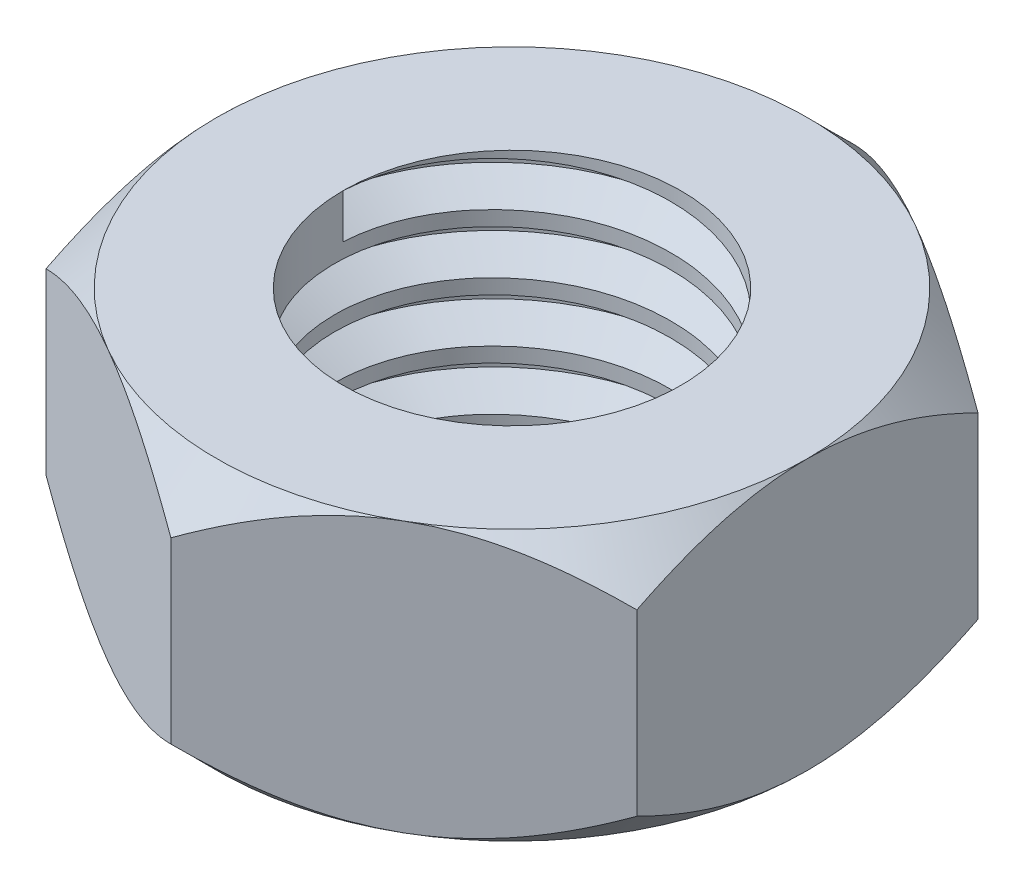
from build123d import *

# Parameters (mm, degrees)
BOSS_EXTRUDE2_DEPTH = 3.2
SKETCH2_R           = 2
CUT_EXTRUDE2_DEPTH  = 7.23083729
SKETCH3_OUTSIDE_W   = 17.632
SKETCH3_OUTSIDE_H   = 18.714
SKETCH3_OUTSIDE_R   = 3.5
CUT_EXTRUDE3_DEPTH  = 3.2
CUT_EXTRUDE3_DRAFT  = -45
SKETCH4_OUTSIDE_W   = 17.632
SKETCH4_OUTSIDE_H   = 18.714
SKETCH4_OUTSIDE_R   = 3.5
CUT_EXTRUDE4_DEPTH  = 3.2
CUT_EXTRUDE4_DRAFT  = -45
THREAD1_PITCH       = 0.7


with BuildPart() as part:
    # Sketch1 → Boss-Extrude2 (new body)
    with BuildSketch(Plane(origin=(0, 0, 0), x_dir=(1, 0, 0), z_dir=(0, 1, 0))):
        Polygon((0, 4.041451884), (-3.5, 2.020725942), (-3.5, -2.020725942), (0, -4.041451884), (3.5, -2.020725942), (3.5, 2.020725942), align=None)
    extrude(amount=BOSS_EXTRUDE2_DEPTH)

    # Sketch2 → Cut-Extrude2 (cut, through all)
    with BuildSketch(Plane(origin=(0, 3.2, 0), x_dir=(1, 0, 0), z_dir=(0, 1, 0))):
        with Locations(Location((0, 0, 0), (0, 0, 270))):
            Circle(SKETCH2_R)
    extrude(amount=-CUT_EXTRUDE2_DEPTH, mode=Mode.SUBTRACT)


with BuildPart() as cut_extrude3_tool:
    # Sketch3 outside → Cut-Extrude3 (with draft: the straight prism first)
    with BuildSketch(Plane(origin=(0, 3.2, 0), x_dir=(1, 0, 0), z_dir=(0, 1, 0))):
        Rectangle(SKETCH3_OUTSIDE_W, SKETCH3_OUTSIDE_H)
        Circle(SKETCH3_OUTSIDE_R, mode=Mode.SUBTRACT)
    extrude(amount=-CUT_EXTRUDE3_DEPTH)
    # Cut-Extrude3: the draft: its side faces are tilted about the plane it starts from
    cut_extrude3_sides = [cut_extrude3_tool.faces().sort_by_distance(p)[0] for p in [
        (0, 1.6, 9.357),
        (8.816, 1.6, 0),
        (0, 1.6, -9.357),
        (-8.816, 1.6, 0),
        (-3.5, 1.6, 0),
    ]]
    draft(cut_extrude3_sides, Plane(origin=(0, 3.2, 0), x_dir=(1, 0, 0), z_dir=(0, 1, 0)), CUT_EXTRUDE3_DRAFT)


with BuildPart() as part_1:
    add(part.part)

    # Cut-Extrude3: cut by cut_extrude3_tool
    add(cut_extrude3_tool.part, mode=Mode.SUBTRACT)


with BuildPart() as cut_extrude4_tool:
    # Sketch4 outside → Cut-Extrude4 (with draft: the straight prism first)
    with BuildSketch(Plane.XZ):
        Rectangle(SKETCH4_OUTSIDE_W, SKETCH4_OUTSIDE_H)
        Circle(SKETCH4_OUTSIDE_R, mode=Mode.SUBTRACT)
    extrude(amount=-CUT_EXTRUDE4_DEPTH)
    # Cut-Extrude4: the draft: its side faces are tilted about the plane it starts from
    cut_extrude4_sides = [cut_extrude4_tool.faces().sort_by_distance(p)[0] for p in [
        (0, 1.6, -9.357),
        (8.816, 1.6, 0),
        (0, 1.6, 9.357),
        (-8.816, 1.6, 0),
        (-3.5, 1.6, 0),
    ]]
    draft(cut_extrude4_sides, Plane.XZ, CUT_EXTRUDE4_DRAFT)


with BuildPart() as part_2:
    add(part_1.part)

    # Cut-Extrude4: cut by cut_extrude4_tool
    add(cut_extrude4_tool.part, mode=Mode.SUBTRACT)

    # Thread1: the profile of Thread Profile1 profile screwed along a right-hand helix of 5.714286 turns, 6 arcs to a turn; built about Z, then put on its axis
    thread1_z = Axis((0, 0, 0), (0, 0, 1))
    thread1_corners = [(1.9997, 0, -0.000173205), (2.378886113, 0, 0.218749999), (2.378886113, 0, 0.306249999), (1.9997, 0, 0.525173203)]
    with BuildLine(mode=Mode.PRIVATE) as thread1_profile:
        Line(thread1_corners[0], thread1_corners[1])
        Line(thread1_corners[1], thread1_corners[2])
        Line(thread1_corners[2], thread1_corners[3])
        Line(thread1_corners[3], thread1_corners[0])
    thread1_cap = Face(thread1_profile.wire())
    thread1_turn_angles = [0, 30, 60, 90, 120, 150, 180, 210, 240, 270, 300, 330, 360]
    thread1_turn_weights = [1, 0.8660254037844387, 1, 0.8660254037844387, 1, 0.8660254037844387, 1, 0.8660254037844387, 1, 0.8660254037844387, 1, 0.8660254037844387, 1]
    thread1_turn_rails = [Edge.make_bspline([Vector(p[0], p[1], 0).rotate(thread1_z, thread1_turn_angles[k]) / thread1_turn_weights[k] + Vector(0, 0, p[2] + THREAD1_PITCH * thread1_turn_angles[k] / 360) for k in range(13)], [0, 0, 0, 1, 1, 2, 2, 3, 3, 4, 4, 5, 5, 6, 6, 6], 2, thread1_turn_weights) for p in thread1_corners]
    thread1_turn_sides = [Face.make_surface_from_curves(thread1_turn_rails[p[0]], thread1_turn_rails[p[1]]) for p in [(0, 1), (1, 2), (2, 3), (3, 0)]]
    thread1_last_angles = [1800, 1830, 1860, 1890, 1920, 1950, 1980, 2010, 2040, 2048.571428571, 2057.142857143]
    thread1_last_weights = [1, 0.8660254037844387, 1, 0.8660254037844387, 1, 0.8660254037844387, 1, 0.8660254037844387, 1, 0.9888308262251283, 1]
    thread1_last_rails = [Edge.make_bspline([Vector(p[0], p[1], 0).rotate(thread1_z, thread1_last_angles[k]) / thread1_last_weights[k] + Vector(0, 0, p[2] + THREAD1_PITCH * thread1_last_angles[k] / 360) for k in range(11)], [0, 0, 0, 1, 1, 2, 2, 3, 3, 4, 4, 5, 5, 5], 2, thread1_last_weights) for p in thread1_corners]
    thread1_last_sides = [Face.make_surface_from_curves(thread1_last_rails[p[0]], thread1_last_rails[p[1]]) for p in [(0, 1), (1, 2), (2, 3), (3, 0)]]
    thread1 = Plane(origin=(0, 3.2, 0), x_dir=(-1, 0, 0), z_dir=(0, -1, 0)) * Solid(Shell([*[p.moved(Location((0, 0, THREAD1_PITCH * i))) for i in range(5) for p in thread1_turn_sides], *thread1_last_sides, thread1_cap, thread1_cap.rotate(thread1_z, 2057.142857143).moved(Location((0, 0, THREAD1_PITCH * 2057.142857143 / 360)))]))
    add(thread1, mode=Mode.SUBTRACT)


solid = part_2.part
